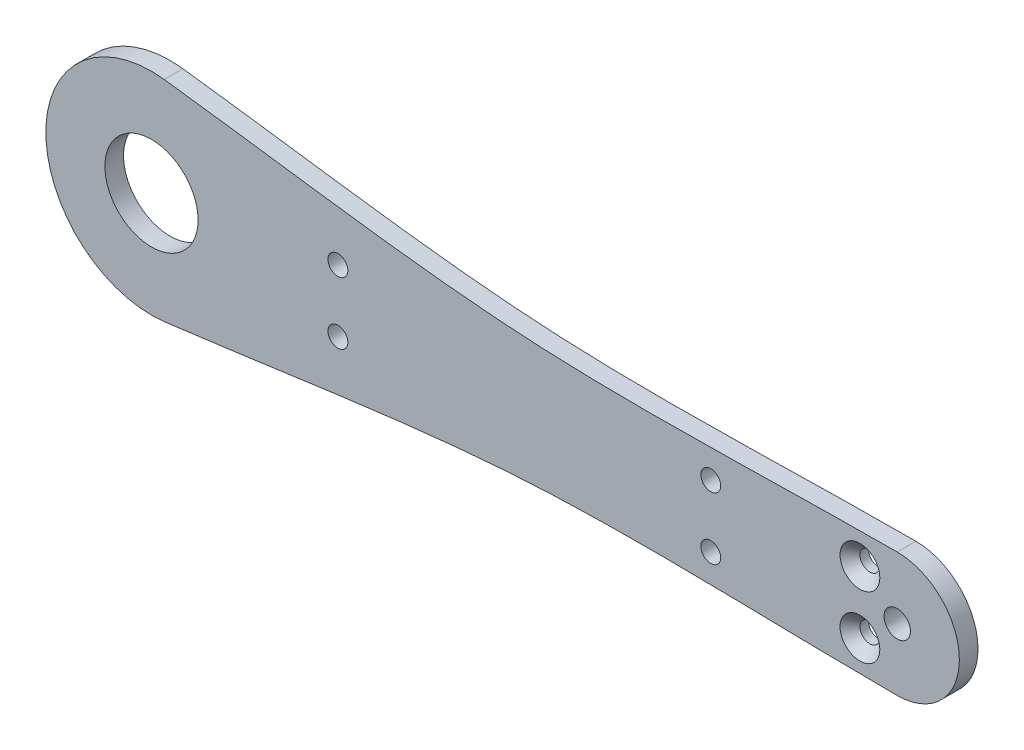
from build123d import *

# Parameters (mm, degrees)
SKETCH1_R           = 7.5
SKETCH1_R_2         = 2.125
SKETCH1_R_3         = 1.6
BOSS_EXTRUDE1_DEPTH = 3
SKETCH2_R           = 1.6
CUT_EXTRUDE1_DEPTH  = 79.91134278
CHAMFER1_SIZE       = 1.6


with BuildPart() as part:
    # Sketch1 → Boss-Extrude1 (new body)
    with BuildSketch(Plane.XY):
        with BuildLine():
            ThreePointArc((-57.956829007, 16.876772567), (-77, 0), (-57.956829007, -16.876772567))
            add(Edge.make_bspline(
                [(60, -10), (39.938279517, -10), (0.415985338, -7.693613776), (-38.598478023, -14.486949791), (-57.956829007, -16.876772567)],
                knots=[0, 0, 0, 0, 0.506913544, 1, 1, 1, 1], degree=3))
            ThreePointArc((60, -10), (70, 0), (60, 10))
            add(Edge.make_bspline(
                [(60, 10), (39.938279517, 10), (0.415985338, 7.693613776), (-38.598478023, 14.486949791), (-57.956829007, 16.876772567)],
                knots=[0, 0, 0, 0, 0.506913544, 1, 1, 1, 1], degree=3))
        make_face()
        with Locations((-60, 0)):
            Circle(SKETCH1_R, mode=Mode.SUBTRACT)
        with Locations((60, 0)):
            Circle(SKETCH1_R_2, mode=Mode.SUBTRACT)
        with Locations((-30, 5)):
            Circle(SKETCH1_R_3, mode=Mode.SUBTRACT)
        with Locations((30, 5)):
            Circle(SKETCH1_R_3, mode=Mode.SUBTRACT)
        with Locations((30, -5)):
            Circle(SKETCH1_R_3, mode=Mode.SUBTRACT)
        with Locations((-30, -5)):
            Circle(SKETCH1_R_3, mode=Mode.SUBTRACT)
    extrude(amount=BOSS_EXTRUDE1_DEPTH)

    # Sketch2 → Cut-Extrude1 (cut, through all)
    with BuildSketch(Plane.XY.offset(3)):
        with Locations((54, 5)):
            Circle(SKETCH2_R)
        with Locations((54, -5)):
            Circle(SKETCH2_R)
    extrude(amount=-CUT_EXTRUDE1_DEPTH, mode=Mode.SUBTRACT)

    # Chamfer1
    chamfer1_edges = [part.edges().sort_by_distance(p)[0] for p in [
        (52.4, -5, 3),
        (52.4, 5, 3),
    ]]
    chamfer(chamfer1_edges, length=CHAMFER1_SIZE)


solid = part.part
